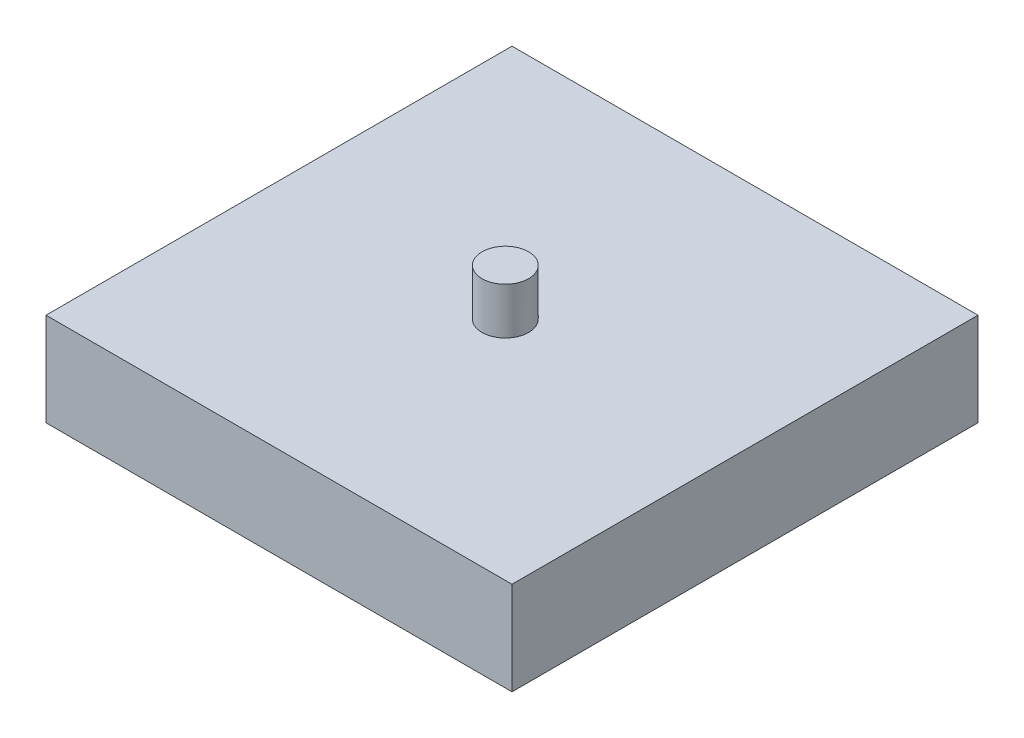
from build123d import *

# Parameters (mm, degrees)
SKETCH2_W           = 500
SKETCH2_H           = 500
BOSS_EXTRUDE1_DEPTH = 100
SKETCH4_R           = 25
BOSS_EXTRUDE3_DEPTH = 50


with BuildPart() as part:
    # Sketch2 → Boss-Extrude1 (new body)
    with BuildSketch(Plane(origin=(0, 0, 0), x_dir=(1, 0, 0), z_dir=(0, 1, 0))):
        with Locations((0, 7.151146392)):
            Rectangle(SKETCH2_W, SKETCH2_H)
    extrude(amount=BOSS_EXTRUDE1_DEPTH)

    # Sketch4 → Boss-Extrude3 (add)
    with BuildSketch(Plane(origin=(0, 100, 0), x_dir=(1, 0, 0), z_dir=(0, 1, 0))):
        Circle(SKETCH4_R)
    extrude(amount=BOSS_EXTRUDE3_DEPTH)


solid = part.part
